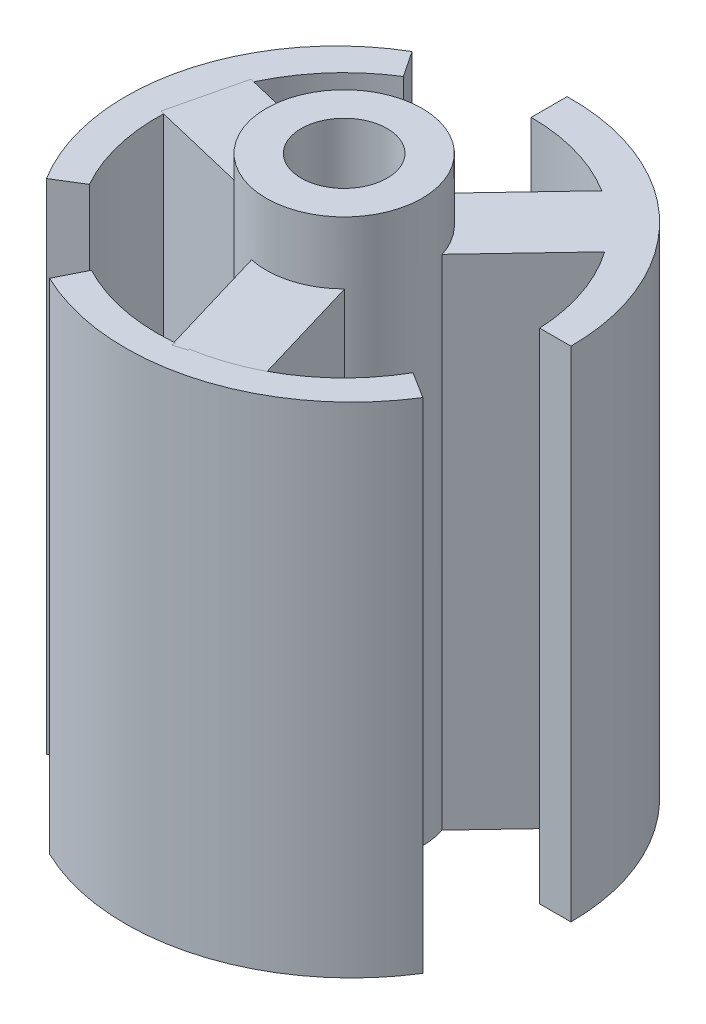
from build123d import *

# Parameters (mm, degrees)
BOSS_EXTRUDE6_DEPTH   = 40
BOSS_EXTRUDE6_2_DEPTH = 40
BOSS_EXTRUDE6_3_DEPTH = 40
SKETCH12_R            = 15
CUT_EXTRUDE9_DEPTH    = 40
BOSS_EXTRUDE8_DEPTH   = 40
SKETCH18_R            = 6.25
BOSS_EXTRUDE9_DEPTH   = 45
SKETCH22_R            = 3.45
CUT_EXTRUDE13_DEPTH   = 52.562685102


with BuildPart() as part:
    # Sketch11 → Boss-Extrude6 (new body)
    with BuildSketch(Plane(origin=(0, 0, 0), x_dir=(1, 0, 0), z_dir=(0, 1, 0))):
        with BuildLine():
            ThreePointArc((-9.349413612, 14.793189822), (-17.216152438, 4.282475359), (-15.190534929, -8.688938287))
            Line((-15.190534929, -8.688938287), (0, 0.700234787))
            Line((0, 0.700234787), (-9.349413612, 14.793189822))
        make_face()
    extrude(amount=BOSS_EXTRUDE6_DEPTH)


with BuildPart() as body_2:
    # Sketch11 → Boss-Extrude6 2 (new body)
    with BuildSketch(Plane(origin=(0, 0, 0), x_dir=(1, 0, 0), z_dir=(0, 1, 0))):
        with BuildLine():
            Line((0, 17.881636961), (0, 0.700234787))
            Line((0, 0.700234787), (17.485984995, 0.700234787))
            ThreePointArc((17.485984995, 0.700234787), (12.345670366, 12.957480113), (0, 17.881636961))
        make_face()
    extrude(amount=BOSS_EXTRUDE6_2_DEPTH)


with BuildPart() as body_3:
    # Sketch11 → Boss-Extrude6 3 (new body)
    with BuildSketch(Plane(origin=(0, 0, 0), x_dir=(1, 0, 0), z_dir=(0, 1, 0))):
        with BuildLine():
            Line((15.120108753, -8.810920002), (0, 0.700234787))
            Line((0, 0.700234787), (-8.136571383, -15.49342461))
            ThreePointArc((-8.136571383, -15.49342461), (4.767573461, -16.592271542), (15.120108753, -8.810920002))
        make_face()
    extrude(amount=BOSS_EXTRUDE6_3_DEPTH)


with BuildPart() as cut_extrude9_tool:
    # Sketch12 → Cut-Extrude9 (new body)
    with BuildSketch(Plane(origin=(0, 0, 0), x_dir=(1, 0, 0), z_dir=(0, 1, 0))):
        Circle(SKETCH12_R)
    extrude(amount=CUT_EXTRUDE9_DEPTH)


with BuildPart() as part_1:
    add(part.part)

    # Cut-Extrude9: cut by cut_extrude9_tool
    add(cut_extrude9_tool.part, mode=Mode.SUBTRACT)


with BuildPart() as body_2_1:
    add(body_2.part)

    # Cut-Extrude9: cut by cut_extrude9_tool
    add(cut_extrude9_tool.part, mode=Mode.SUBTRACT)



with BuildPart() as body_3_1:
    add(body_3.part)

    # Cut-Extrude9: cut by cut_extrude9_tool
    add(cut_extrude9_tool.part, mode=Mode.SUBTRACT)


with BuildPart() as body_4:
    # Sketch17 → Boss-Extrude8 (new body)
    with BuildSketch(Plane(origin=(0, 0, 0), x_dir=(1, 0, 0), z_dir=(0, 1, 0))):
        Polygon((3.368966021, -0.806267914), (12.495130342, 8.824495324), (8.139929807, 12.951507354), (-0.986234515, 3.320744116), (-13.889802298, 6.408852638), (-15.286299289, 0.573632321), (-2.382731506, -2.514476202), (1.394671955, -15.233347962), (7.146369483, -13.525139675), align=None)
    extrude(amount=BOSS_EXTRUDE8_DEPTH)


with BuildPart() as body_2_2:
    add(body_2_1.part)

    add(body_4.part)  # Boss-Extrude9 merges body 4
    # Sketch18 → Boss-Extrude9 (add)
    with BuildSketch(Plane(origin=(0, 0, 0), x_dir=(1, 0, 0), z_dir=(0, 1, 0))):
        Circle(SKETCH18_R)
    extrude(amount=BOSS_EXTRUDE9_DEPTH)

    # Sketch22 → Cut-Extrude13 (cut, through all)
    with BuildSketch(Plane(origin=(0, 0, 0), x_dir=(1, 0, 0), z_dir=(0, 1, 0))):
        Circle(SKETCH22_R)
    extrude(amount=CUT_EXTRUDE13_DEPTH, mode=Mode.SUBTRACT)


solid = Compound([part_1.part, body_3_1.part, body_2_2.part])
